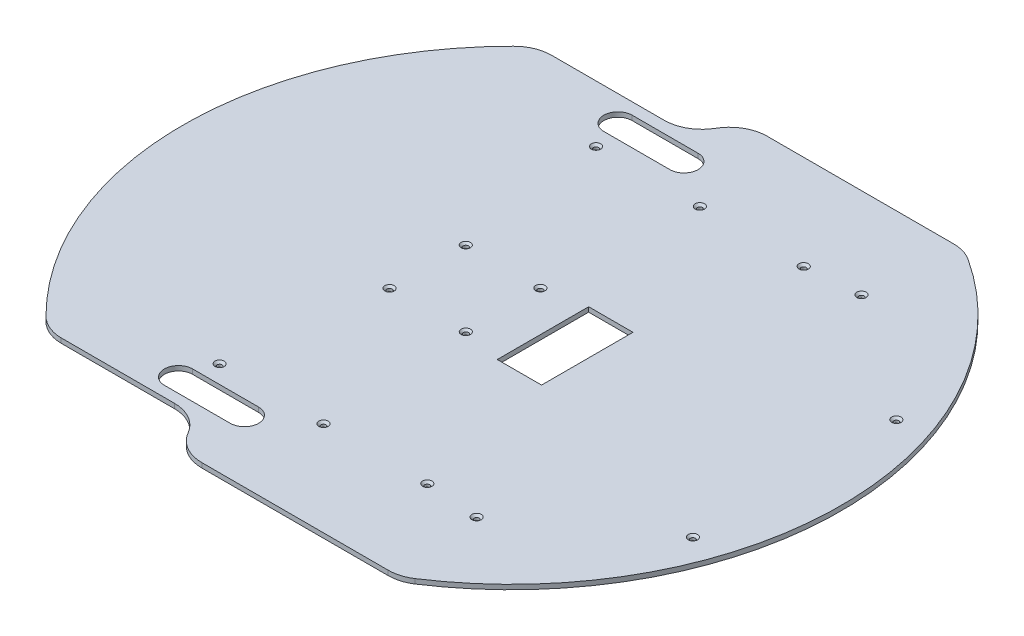
from build123d import *

# Parameters (mm, degrees)
BOSS_EXTRU_1_DEPTH                             = 3.18
ESQUISSE2_W                                    = 29.85
ESQUISSE2_H                                    = 61.6
ENL_V_MAT_EXTRU_1_DEPTH                        = 3.18
FRAISAGE_POUR_VIS_T_TE_FRAIS_E_M31_D           = 3.4
FRAISAGE_POUR_VIS_T_TE_FRAIS_E_M31_CSINK_D     = 6.3
FRAISAGE_POUR_VIS_T_TE_FRAIS_E_M31_CSINK_ANGLE = 90
FRAISAGE_POUR_VIS_T_TE_FRAIS_E_M33_D           = 3.6
FRAISAGE_POUR_VIS_T_TE_FRAIS_E_M33_CSINK_D     = 6.3
FRAISAGE_POUR_VIS_T_TE_FRAIS_E_M33_CSINK_ANGLE = 90


with BuildPart() as part:
    # Esquisse1 → Boss.-Extru.1 (new body)
    with BuildSketch(Plane(origin=(0, 0, 0), x_dir=(1, 0, 0), z_dir=(0, 1, 0))):
        with BuildLine():
            Line((-138.94, 165.455), (-62.65, 165.455))
            ThreePointArc((-62.65, 165.455), (-49.94832469, 168.857215998), (-40.65, 178.155))
            ThreePointArc((-40.65, 178.155), (-31.35167531, 187.452784002), (-18.65, 190.855))
            Line((-18.65, 190.855), (106.95, 190.855))
            ThreePointArc((106.95, 190.855), (114.162170552, 189.807407008), (120.78, 186.755))
            ThreePointArc((120.78, 186.755), (221.783950682, 0.355), (120.78, -186.045))
            ThreePointArc((120.78, -186.045), (114.162170552, -189.097407008), (106.95, -190.145))
            Line((106.95, -190.145), (-18.65, -190.145))
            ThreePointArc((-18.65, -190.145), (-31.35167531, -186.742784002), (-40.65, -177.445))
            ThreePointArc((-40.65, -177.445), (-49.94832469, -168.147215998), (-62.65, -164.745))
            Line((-62.65, -164.745), (-138.94, -164.745))
            ThreePointArc((-138.94, -164.745), (-148.655863056, -162.664054344), (-156.83, -157.015))
            ThreePointArc((-156.83, -157.015), (-222.037491914, 0.355), (-156.83, 157.725))
            ThreePointArc((-156.83, 157.725), (-148.655863056, 163.374054344), (-138.94, 165.455))
        make_face()
    extrude(amount=BOSS_EXTRU_1_DEPTH)

    # Esquisse2 → Enlèv. mat.-Extru.1 (cut)
    with BuildSketch(Plane(origin=(0, 3.18, 0), x_dir=(1, 0, 0), z_dir=(0, 1, 0))):
        with BuildLine():
            Line((-76.45, -138.575), (-32, -138.575))
            ThreePointArc((-32, -138.575), (-22.47, -148.105), (-32, -157.635))
            Line((-32, -157.635), (-76.45, -157.635))
            ThreePointArc((-76.45, -157.635), (-85.98, -148.105), (-76.45, -138.575))
        make_face()
        with BuildLine():
            Line((-76.45, 138.575), (-32, 138.575))
            ThreePointArc((-32, 138.575), (-22.47, 148.105), (-32, 157.635))
            Line((-32, 157.635), (-76.45, 157.635))
            ThreePointArc((-76.45, 157.635), (-85.98, 148.105), (-76.45, 138.575))
        make_face()
        with Locations((35.625, 0.375)):
            Rectangle(ESQUISSE2_W, ESQUISSE2_H)
    extrude(amount=-ENL_V_MAT_EXTRU_1_DEPTH, mode=Mode.SUBTRACT)

    # Fraisage pour vis à tête fraisée M31 (through all)
    with Locations(Plane(origin=(-70.35, 3.18, 126.475), x_dir=(0, 0, 1), z_dir=(0, 1, 0))):
        with Locations((0, 0), (0, 69.98), (0, 139.96), (2.87, 176.05), (-58.27, 260.67), (-195.39, 260.67), (-256.53, 176.05), (-253.66, 139.96), (-253.66, 69.98), (-253.66, 0)):
            CounterSinkHole(FRAISAGE_POUR_VIS_T_TE_FRAIS_E_M31_D / 2, FRAISAGE_POUR_VIS_T_TE_FRAIS_E_M31_CSINK_D / 2, counter_sink_angle=FRAISAGE_POUR_VIS_T_TE_FRAIS_E_M31_CSINK_ANGLE)

    # Fraisage pour vis à tête fraisée M33 (through all)
    with Locations(Plane(origin=(-56.696636833, 3.18, -25.755), x_dir=(0, 0, 1), z_dir=(0, 1, 0))):
        with Locations((0, 0), (0, 50.276636833), (50.601243407, 50.6422972), (50.936723508, -0.430840352)):
            CounterSinkHole(FRAISAGE_POUR_VIS_T_TE_FRAIS_E_M33_D / 2, FRAISAGE_POUR_VIS_T_TE_FRAIS_E_M33_CSINK_D / 2, counter_sink_angle=FRAISAGE_POUR_VIS_T_TE_FRAIS_E_M33_CSINK_ANGLE)


solid = part.part
